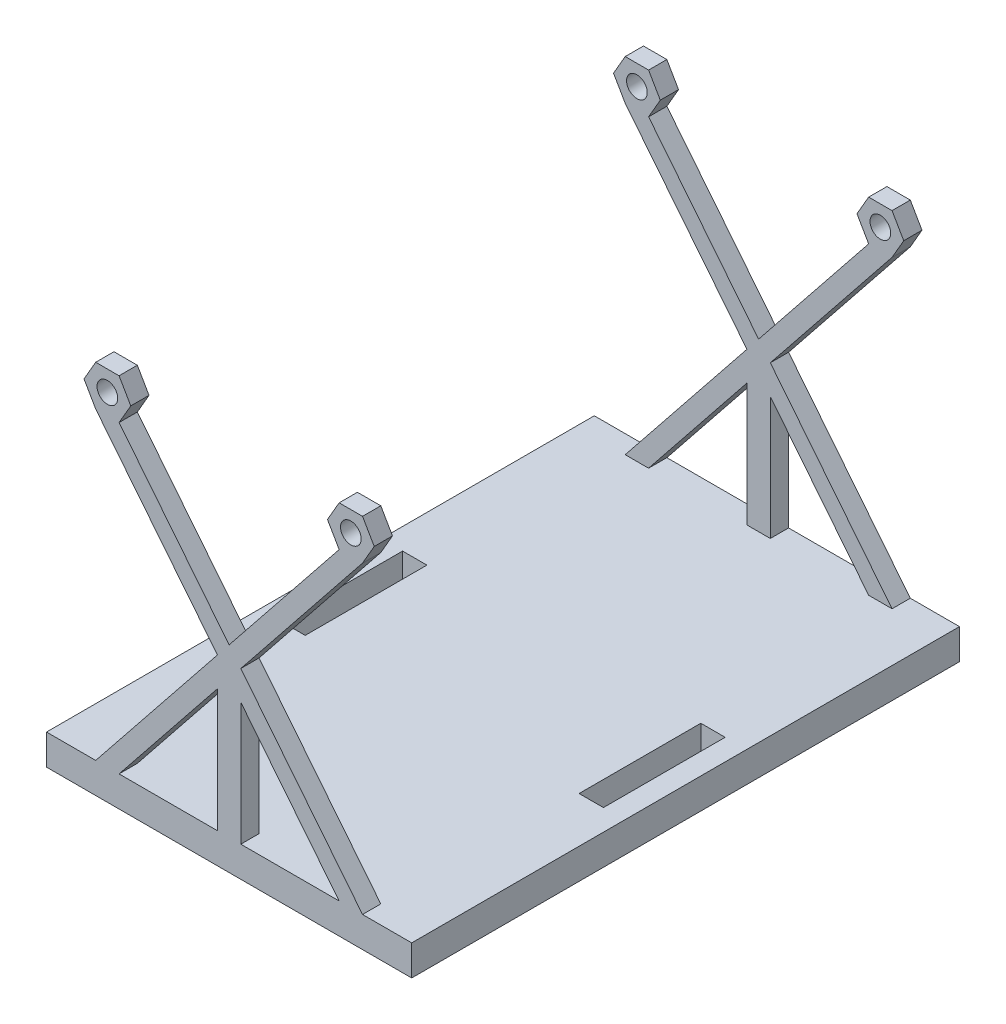
from build123d import *

# Parameters (mm, degrees)
SKETCH2_W                     = 60
SKETCH2_H                     = 90
SKETCH2_W_2                   = 4
SKETCH2_H_2                   = 20
BOSS_EXTRUDE1_DEPTH           = 2.5
BOSS_EXTRUDE2_DEPTH           = 3
BOSS_EXTRUDE3_DEPTH           = 3
M3_CLEARANCE_HOLE1_AT_2_COUNT = 2
M3_CLEARANCE_HOLE1_AT_2_PITCH = 40


with BuildPart() as part:
    # Sketch2 → Boss-Extrude1 (new, symmetric)
    with BuildSketch(Plane(origin=(0, 0, 0), x_dir=(1, 0, 0), z_dir=(0, 1, 0))):
        Rectangle(SKETCH2_W, SKETCH2_H)
        with Locations((-24.5, 0)):
            Rectangle(SKETCH2_W_2, SKETCH2_H_2, mode=Mode.SUBTRACT)
        with Locations((24.5, 0)):
            Rectangle(SKETCH2_W_2, SKETCH2_H_2, mode=Mode.SUBTRACT)
    extrude(amount=BOSS_EXTRUDE1_DEPTH, both=True)

    # Sketch3 → Boss-Extrude2 (add)
    with BuildSketch(Plane.XY.offset(45)):
        Polygon((-1.920937271, 27.5), (-21.920937271, 2.5), (-18.079062729, 2.5), (-1.920937271, 22.697656822), (-1.920937271, 2.5), (1.920937271, 2.5), (1.920937271, 22.697656822), (18.079062729, 2.5), (21.920937271, 2.5), (1.920937271, 27.5), (21.920937271, 52.5), (18.079062729, 52.5), (0, 29.901171589), (-18.079062729, 52.5), (-21.920937271, 52.5), align=None)
    boss_extrude2 = extrude(amount=-BOSS_EXTRUDE2_DEPTH)

    # Sketch6 → Boss-Extrude3 (add)
    with BuildSketch(Plane.XY.offset(45)):
        Polygon((21.920937271, 59.154321904), (18.079062729, 59.154321904), (16.158125458, 55.827160952), (18.079062729, 52.5), (21.920937271, 52.5), (23.841874542, 55.827160952), align=None)
        Polygon((-23.841874542, 55.827160952), (-21.920937271, 59.154321904), (-18.079062729, 59.154321904), (-16.158125458, 55.827160952), (-18.079062729, 52.5), (-21.920937271, 52.5), align=None)
    boss_extrude3 = extrude(amount=-BOSS_EXTRUDE3_DEPTH)

    # Sketch8 → M3 Clearance Hole1 (revolve, cut)
    with BuildSketch(Plane(origin=(20, 55.827160952, 45), x_dir=(0, -1, 0), z_dir=(1, 0, 0))):
        Polygon((0, 0), (0, 88.020463052), (1.7, 86.999), (1.7, 0), align=None)
    m3_clearance_hole1 = revolve(axis=Axis((20, 55.827160952, 51.35), (0, 0, -1)), mode=Mode.SUBTRACT)

    # M3 Clearance Hole1 at 2: M3 Clearance Hole1 ×2
    with Locations(*[(-i * M3_CLEARANCE_HOLE1_AT_2_PITCH, 0, 0) for i in range(1, M3_CLEARANCE_HOLE1_AT_2_COUNT)]):
        add(m3_clearance_hole1, mode=Mode.SUBTRACT)

    # Mirror1: Boss-Extrude2, Boss-Extrude3, M3 Clearance Hole1 across plane
    add(boss_extrude2.mirror(Plane.XY))
    add(boss_extrude3.mirror(Plane.XY))
    add(m3_clearance_hole1.mirror(Plane.XY), mode=Mode.SUBTRACT)

    # Mirror1 copy 1 sketch → Mirror1 copy 1 (revolve, cut)
    with BuildSketch(Plane(origin=(-20, 55.827160952, -45), x_dir=(0, -1, 0), z_dir=(1, 0, 0))):
        Polygon((0, 0), (0, -88.020463052), (1.7, -86.999), (1.7, 0), align=None)
    revolve(axis=Axis((-20, 55.827160952, -51.35), (0, 0, -1)), mode=Mode.SUBTRACT)


solid = part.part
